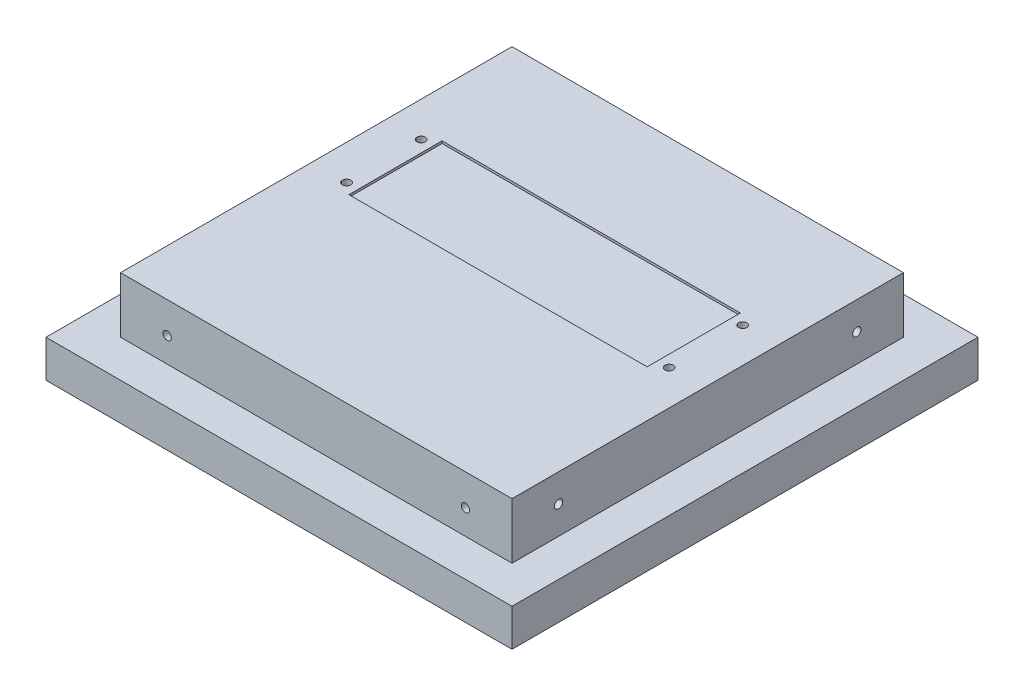
from build123d import *

# Parameters (mm, degrees)
SKETCH1_W                           = 100
SKETCH1_H                           = 100
BOSS_EXTRUDE2_DEPTH                 = 8
SKETCH2_W                           = 84
SKETCH2_H                           = 84
BOSS_EXTRUDE3_DEPTH                 = 12
SKETCH3_W                           = 64
SKETCH3_H                           = 20
CUT_EXTRUDE1_DEPTH                  = 0.5
F_2_56_TAPPED_HOLE1_D               = 1.778
F_2_56_TAPPED_HOLE1_DEPTH           = 15
F_2_56_TAPPED_HOLE1_TIP             = 0.53416509
F_2_56_TAPPED_HOLE2_D               = 1.778
F_2_56_TAPPED_HOLE2_DEPTH           = 7
F_2_56_TAPPED_HOLE2_TIP             = 0.53416509
F_2_56_TAPPED_HOLE2_ON_FACE_2_D     = 1.778
F_2_56_TAPPED_HOLE2_ON_FACE_2_DEPTH = 7
F_2_56_TAPPED_HOLE2_ON_FACE_2_TIP   = 0.53416509
F_2_56_TAPPED_HOLE3_D               = 1.778
F_2_56_TAPPED_HOLE3_DEPTH           = 7
F_2_56_TAPPED_HOLE3_TIP             = 0.53416509
F_2_56_TAPPED_HOLE3_ON_FACE_2_D     = 1.778
F_2_56_TAPPED_HOLE3_ON_FACE_2_DEPTH = 7
F_2_56_TAPPED_HOLE3_ON_FACE_2_TIP   = 0.53416509
F_2_56_TAPPED_HOLE4_D               = 1.778
F_2_56_TAPPED_HOLE4_DEPTH           = 7
F_2_56_TAPPED_HOLE4_TIP             = 0.53416509
F_1_4_20_TAPPED_HOLE1_D             = 5.1054
F_1_4_20_TAPPED_HOLE1_DEPTH         = 8
F_1_4_20_TAPPED_HOLE1_TIP           = 1.533816902


with BuildPart() as part:
    # Sketch1 → Boss-Extrude2 (new body)
    with BuildSketch(Plane(origin=(0, 0, 0), x_dir=(1, 0, 0), z_dir=(0, 1, 0))):
        Rectangle(SKETCH1_W, SKETCH1_H)
    extrude(amount=BOSS_EXTRUDE2_DEPTH)

    # Sketch2 → Boss-Extrude3 (add)
    with BuildSketch(Plane(origin=(0, 8, 0), x_dir=(1, 0, 0), z_dir=(0, 1, 0))):
        Rectangle(SKETCH2_W, SKETCH2_H)
    extrude(amount=BOSS_EXTRUDE3_DEPTH)

    # Sketch3 → Cut-Extrude1 (cut)
    with BuildSketch(Plane(origin=(0, 20, 0), x_dir=(1, 0, 0), z_dir=(0, 1, 0))):
        with Locations((0, 7)):
            Rectangle(SKETCH3_W, SKETCH3_H)
    extrude(amount=-CUT_EXTRUDE1_DEPTH, mode=Mode.SUBTRACT)

    # #2-56 Tapped Hole1
    with Locations(Plane(origin=(34.5, 20, 0.771340353), x_dir=(0, 0, 1), z_dir=(0, 1, 0))):
        with Locations((0, 0), (-15.771340353, 0), (-15.771340353, -69), (0.228659647, -69)):
            Hole(F_2_56_TAPPED_HOLE1_D / 2, depth=F_2_56_TAPPED_HOLE1_DEPTH)
            with Locations((0, 0, -(F_2_56_TAPPED_HOLE1_DEPTH + F_2_56_TAPPED_HOLE1_TIP / 2))):  # 118° drill point
                Cone(0, F_2_56_TAPPED_HOLE1_D / 2, F_2_56_TAPPED_HOLE1_TIP, mode=Mode.SUBTRACT)

    # #2-56 Tapped Hole2
    with Locations(Plane(origin=(-32, 13.303798936, 42), x_dir=(1, 0, 0), z_dir=(0, 0, 1))):
        with Locations((0, 0), (64, 0)):
            Hole(F_2_56_TAPPED_HOLE2_D / 2, depth=F_2_56_TAPPED_HOLE2_DEPTH)
            with Locations((0, 0, -(F_2_56_TAPPED_HOLE2_DEPTH + F_2_56_TAPPED_HOLE2_TIP / 2))):  # 118° drill point
                Cone(0, F_2_56_TAPPED_HOLE2_D / 2, F_2_56_TAPPED_HOLE2_TIP, mode=Mode.SUBTRACT)

    # #2-56 Tapped Hole2 on face 2
    with Locations(Plane(origin=(-42, 13.303798936, 32), x_dir=(0, 0, -1), z_dir=(-1, 0, 0))):
        with Locations((0, 0)):
            Hole(F_2_56_TAPPED_HOLE2_ON_FACE_2_D / 2, depth=F_2_56_TAPPED_HOLE2_ON_FACE_2_DEPTH)
            with Locations((0, 0, -(F_2_56_TAPPED_HOLE2_ON_FACE_2_DEPTH + F_2_56_TAPPED_HOLE2_ON_FACE_2_TIP / 2))):  # 118° drill point
                Cone(0, F_2_56_TAPPED_HOLE2_ON_FACE_2_D / 2, F_2_56_TAPPED_HOLE2_ON_FACE_2_TIP, mode=Mode.SUBTRACT)

    # #2-56 Tapped Hole3
    with Locations(Plane(origin=(42, 14, 32), x_dir=(0, 0, 1), z_dir=(1, 0, 0))):
        with Locations((0, 0), (-64, 0)):
            Hole(F_2_56_TAPPED_HOLE3_D / 2, depth=F_2_56_TAPPED_HOLE3_DEPTH)
            with Locations((0, 0, -(F_2_56_TAPPED_HOLE3_DEPTH + F_2_56_TAPPED_HOLE3_TIP / 2))):  # 118° drill point
                Cone(0, F_2_56_TAPPED_HOLE3_D / 2, F_2_56_TAPPED_HOLE3_TIP, mode=Mode.SUBTRACT)

    # #2-56 Tapped Hole3 on face 2
    with Locations(Plane(origin=(32, 14, -42), x_dir=(-1, 0, 0), z_dir=(0, 0, -1))):
        with Locations((0, 0), (64, -0.696201064)):
            Hole(F_2_56_TAPPED_HOLE3_ON_FACE_2_D / 2, depth=F_2_56_TAPPED_HOLE3_ON_FACE_2_DEPTH)
            with Locations((0, 0, -(F_2_56_TAPPED_HOLE3_ON_FACE_2_DEPTH + F_2_56_TAPPED_HOLE3_ON_FACE_2_TIP / 2))):  # 118° drill point
                Cone(0, F_2_56_TAPPED_HOLE3_ON_FACE_2_D / 2, F_2_56_TAPPED_HOLE3_ON_FACE_2_TIP, mode=Mode.SUBTRACT)

    # #2-56 Tapped Hole4
    with Locations(Plane(origin=(-42, 13.303798936, -32), x_dir=(0, 0, -1), z_dir=(-1, 0, 0))):
        with Locations((0, 0)):
            Hole(F_2_56_TAPPED_HOLE4_D / 2, depth=F_2_56_TAPPED_HOLE4_DEPTH)
            with Locations((0, 0, -(F_2_56_TAPPED_HOLE4_DEPTH + F_2_56_TAPPED_HOLE4_TIP / 2))):  # 118° drill point
                Cone(0, F_2_56_TAPPED_HOLE4_D / 2, F_2_56_TAPPED_HOLE4_TIP, mode=Mode.SUBTRACT)

    # 1/4-20 Tapped Hole1
    with Locations(Plane(origin=(-30, 0, -30), x_dir=(0, 0, -1), z_dir=(0, -1, 0))):
        with Locations((0, 0), (-60, 0), (-60, 60), (0, 60)):
            Hole(F_1_4_20_TAPPED_HOLE1_D / 2, depth=F_1_4_20_TAPPED_HOLE1_DEPTH)
            with Locations((0, 0, -(F_1_4_20_TAPPED_HOLE1_DEPTH + F_1_4_20_TAPPED_HOLE1_TIP / 2))):  # 118° drill point
                Cone(0, F_1_4_20_TAPPED_HOLE1_D / 2, F_1_4_20_TAPPED_HOLE1_TIP, mode=Mode.SUBTRACT)


solid = part.part
